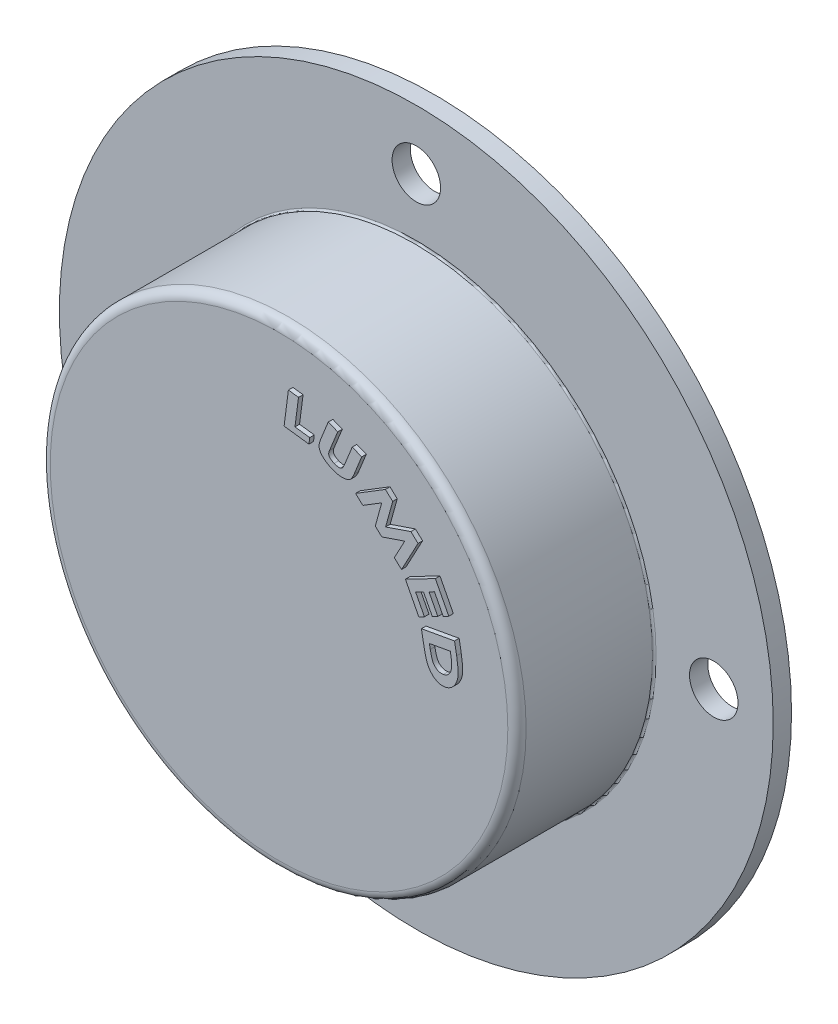
from build123d import *

# Parameters (mm, degrees)
SKETCH1_R            = 39
EXTRUDE1_DEPTH       = 2
SKETCH2_R            = 26
EXTRUDE3_DEPTH       = 15
FILLET1_R            = 1
SHELL1_OUTLINE_R     = 24
SHELL1_DEPTH         = 15
FILLET3_R            = 0.2
FILLET4_R            = 0.5
FILLET5_R            = 1
M5_CLEARANCE_HOLE2_D = 5.3
CIRPATTERN2_COUNT    = 4
EXTRUDE4_DEPTH       = 0.5


# Read off the part's stored shape, not the designer's step: Shell1
with BuildPart() as part:
    # Sketch1 → Extrude1 (new body)
    with BuildSketch(Plane.XY):
        Circle(SKETCH1_R)
    extrude(amount=EXTRUDE1_DEPTH)

    # Sketch2 → Extrude3 (add)
    with BuildSketch(Plane.XY.offset(2)):
        Circle(SKETCH2_R)
    extrude(amount=EXTRUDE3_DEPTH)

    # Fillet1
    fillet1_edges = [part.edges().sort_by_distance(p)[0] for p in [
        (-26, 0, 17),
    ]]
    fillet(fillet1_edges, radius=FILLET1_R)

    # Shell1 outline → Shell1 (cut)
    with BuildSketch(Plane.XY):
        Circle(SHELL1_OUTLINE_R)
    extrude(amount=SHELL1_DEPTH, mode=Mode.SUBTRACT)

    # Fillet3
    fillet3_edges = [part.edges().sort_by_distance(p)[0] for p in [
        (-26, 0, 2),
    ]]
    fillet(fillet3_edges, radius=FILLET3_R)

    # Fillet4
    fillet4_edges = [part.edges().sort_by_distance(p)[0] for p in [
        (-24, 0, 0),
    ]]
    fillet(fillet4_edges, radius=FILLET4_R)

    # Fillet5
    fillet5_edges = [part.edges().sort_by_distance(p)[0] for p in [
        (-24, 0, 15),
    ]]
    fillet(fillet5_edges, radius=FILLET5_R)

    # M5 Clearance Hole2 (through all)
    with Locations(Plane.XY.offset(2)):
        with Locations((0, 32.5)):
            m5_clearance_hole2 = Hole(M5_CLEARANCE_HOLE2_D / 2)

    # CirPattern2: M5 Clearance Hole2 ×4 about axis
    cirpattern2_axis = Axis((0, 0, 0), (0, 0, 1))
    for i in range(1, CIRPATTERN2_COUNT):
        add(m5_clearance_hole2.rotate(cirpattern2_axis, i * 360 / CIRPATTERN2_COUNT), mode=Mode.SUBTRACT)

    # Sketch7 → Extrude4 (add)
    # profile 1 of 5: a face of its own
    with BuildSketch(Plane.XY.offset(17)):
        with BuildLine():
            Line((19.676957621, 5.895197773), (19.909210058, 4.601855926))
            add(Edge.make_bspline(
                [(19.909210058, 4.601855926), (19.926651632, 4.500756414), (19.960375824, 4.305275227), (20.003127109, 4.021131614), (20.035136253, 3.755856277), (20.057801947, 3.50941192), (20.070613778, 3.281967505), (20.074435398, 3.073479481), (20.066961458, 2.884011603), (20.051245996, 2.710939809), (20.024412986, 2.550248712), (19.989932757, 2.397223976), (19.945515818, 2.249766305), (19.894274619, 2.106997056), (19.832166687, 1.970108117), (19.761460303, 1.838667258), (19.682767862, 1.711818388), (19.595037947, 1.5917147), (19.499748057, 1.479638905), (19.396983344, 1.377993746), (19.28704005, 1.288275306), (19.170652181, 1.209353696), (19.046580749, 1.143616013), (18.91635037, 1.087389919), (18.77889519, 1.043285188), (18.68385402, 1.023944482), (18.635902767, 1.014186489)],
                knots=[0, 0, 0, 0, 1.730076892, 3.345194012, 4.845031028, 6.235470528, 7.517952796, 8.685973408, 9.750415481, 10.714141801, 11.614495518, 12.495817449, 13.357576408, 14.209987726, 15.051935834, 15.889834422, 16.725466702, 17.567259816, 18.395636046, 19.203792226, 20.001166367, 20.785517328, 21.571153748, 22.36530307, 23.175244092, 24, 24, 24, 24], degree=3))
            add(Edge.make_bspline(
                [(18.635902767, 1.014186489), (18.601332211, 1.008792177), (18.532676771, 0.998079338), (18.429279177, 0.989999215), (18.326869474, 0.989175032), (18.22517881, 0.995885426), (18.124571089, 1.010143405), (18.024571455, 1.030831771), (17.925656818, 1.059215457), (17.827998765, 1.094745096), (17.732265048, 1.137285173), (17.638741204, 1.185398285), (17.548021241, 1.239670585), (17.460576449, 1.300003798), (17.375273895, 1.365504104), (17.293439096, 1.437570028), (17.213363047, 1.514802593), (17.112225961, 1.626941287), (16.993341681, 1.77534263), (16.86772283, 1.966533878), (16.757516889, 2.168158053), (16.678159583, 2.347681675), (16.62103193, 2.506628847), (16.578084306, 2.647799896), (16.532403009, 2.80962355), (16.487908625, 2.993283627), (16.441312375, 3.197882505), (16.392833179, 3.423332012), (16.345041361, 3.670140713), (16.313480153, 3.841752829), (16.297053942, 3.931069335)],
                knots=[0, 0, 0, 0, 0.700069007, 1.390302967, 2.07345339, 2.748157948, 3.427928198, 4.105586319, 4.790313218, 5.485605459, 6.183746622, 6.885581077, 7.589368078, 8.297874576, 9.010777227, 9.740496332, 10.479143782, 11.236028141, 12.761351436, 14.279847751, 15.808380735, 17.355454046, 18.202580936, 19.187428998, 20.308031537, 21.567474943, 22.968881258, 24.507767656, 26.182447736, 28, 28, 28, 28], degree=3))
            Line((16.297053942, 3.931069335), (16.061091402, 5.244445737))
            Line((16.061091402, 5.244445737), (19.676957621, 5.895197773))
        make_face()
        with BuildLine():
            Line((19.208000623, 4.688672333), (16.929997485, 4.27833496))
            Line((16.929997485, 4.27833496), (17.021266015, 3.771534913))
            add(Edge.make_bspline(
                [(17.021266015, 3.771534913), (17.032345987, 3.711373225), (17.053733, 3.595246685), (17.089409635, 3.428546915), (17.125904798, 3.275194319), (17.162274443, 3.135102557), (17.201293405, 3.00858141), (17.239805196, 2.895047806), (17.280674034, 2.795284581), (17.322803022, 2.707562492), (17.367167925, 2.628795417), (17.415768928, 2.556722787), (17.467747655, 2.489006687), (17.5235422, 2.425554712), (17.583554861, 2.366990452), (17.647740166, 2.313415224), (17.715443468, 2.264358919), (17.78654117, 2.219690581), (17.86093744, 2.180915018), (17.938988478, 2.150582726), (18.019080747, 2.126625083), (18.101820962, 2.110326722), (18.187002339, 2.10138524), (18.27462071, 2.100115904), (18.364754991, 2.105817523), (18.424984256, 2.11557869), (18.455591769, 2.120539153)],
                knots=[0, 0, 0, 0, 1.775092123, 3.426355128, 4.946159467, 6.349362224, 7.625332135, 8.787500866, 9.827139712, 10.751664961, 11.609871591, 12.447943051, 13.271974121, 14.085592912, 14.897690682, 15.702716349, 16.509563741, 17.322105437, 18.137463576, 18.939829159, 19.748303036, 20.560495954, 21.383244435, 22.230303678, 23.100669685, 24, 24, 24, 24], degree=3))
            add(Edge.make_bspline(
                [(18.455591769, 2.120539153), (18.501912095, 2.1305263), (18.592653852, 2.150091173), (18.721035792, 2.198320249), (18.838930231, 2.260006867), (18.945420071, 2.337235377), (19.040204715, 2.429694213), (19.124665474, 2.535983583), (19.198010124, 2.656956303), (19.236010853, 2.745299303), (19.255489939, 2.790583724)],
                knots=[0, 0, 0, 0, 1.038177342, 2.033794765, 2.997232208, 3.948913134, 4.908064258, 5.892578705, 6.919740629, 8, 8, 8, 8], degree=3))
            add(Edge.make_bspline(
                [(19.255489939, 2.790583724), (19.271340372, 2.835554425), (19.304366828, 2.929256779), (19.335515387, 3.082108884), (19.356237644, 3.249799018), (19.363578257, 3.433371754), (19.359499759, 3.632545511), (19.343394445, 3.847458387), (19.316080336, 4.078281915), (19.288886141, 4.236399757), (19.274782474, 4.31840407)],
                knots=[0, 0, 0, 0, 0.739780208, 1.541429103, 2.416204183, 3.362112403, 4.391764505, 5.508663336, 6.707923483, 8, 8, 8, 8], degree=3))
            Line((19.274782474, 4.31840407), (19.208000623, 4.688672333))
        make_face(mode=Mode.SUBTRACT)
    # profile 2 of 5: a face of its own
    with BuildSketch(Plane.XY.offset(17)):
        Polygon((17.581435301, 10.747395777), (19.049151981, 7.917329337), (18.439211075, 7.601228576), (17.479778483, 9.451827868), (16.887646071, 9.144631354), (17.847078663, 7.294032062), (17.248268066, 6.983867465), (16.288835474, 8.834466757), (15.427349597, 8.388512397), (16.386782189, 6.537913105), (15.774615222, 6.220328302), (14.306898542, 9.050394742), align=None)
    # profile 3 of 5: a face of its own
    with BuildSketch(Plane.XY.offset(17)):
        Polygon((12.123844788, 16.457580555), (12.917806794, 15.714817969), (12.143879344, 12.912948311), (14.90345383, 13.856798471), (15.686285527, 13.124424172), (13.88243353, 9.757134842), (13.100343854, 10.488767121), (14.234893299, 12.619108166), (11.735026012, 11.766526536), (11.018976165, 12.436571107), (11.715733477, 14.975765485), (9.656626406, 13.71136244), (8.865632482, 14.451156944), align=None)
    # profile 4 of 5: a face of its own
    with BuildSketch(Plane.XY.offset(17)):
        with BuildLine():
            Line((5.883258698, 19.717752428), (6.913183244, 19.299994849))
            Line((6.913183244, 19.299994849), (6.01756442, 17.092483664))
            add(Edge.make_bspline(
                [(6.01756442, 17.092483664), (6.008486233, 17.069548786), (5.990944466, 17.025231756), (5.968459411, 16.960233961), (5.951756013, 16.899082481), (5.937700658, 16.842866609), (5.929563581, 16.790459558), (5.925628424, 16.742326117), (5.926160317, 16.698062126), (5.932981546, 16.644156349), (5.953878485, 16.579582514), (5.992366342, 16.504378403), (6.046995799, 16.430571608), (6.116233762, 16.35835831), (6.199026795, 16.288695912), (6.296204469, 16.225423966), (6.404381617, 16.164332538), (6.483415994, 16.131018738), (6.524364467, 16.113758537)],
                knots=[0, 0, 0, 0, 0.923038225, 1.783585378, 2.571857434, 3.294764068, 3.950625969, 4.554034933, 5.100209756, 5.604208717, 6.582094882, 7.621105052, 8.754146159, 10.004648243, 11.358032571, 12.793050822, 14.338448695, 16, 16, 16, 16], degree=3))
            add(Edge.make_bspline(
                [(6.524364467, 16.113758537), (6.568381949, 16.096937583), (6.653613085, 16.064367136), (6.781720621, 16.029178008), (6.904523521, 16.008154167), (7.020730873, 16.000176227), (7.127582444, 16.005957413), (7.223056232, 16.022459059), (7.306086108, 16.050112017), (7.366327548, 16.0847227), (7.408808112, 16.121187462), (7.440283212, 16.156538569), (7.473227208, 16.198887508), (7.50531201, 16.249796421), (7.539045, 16.307675031), (7.572073799, 16.374126456), (7.606128878, 16.448155364), (7.628152069, 16.500530119), (7.639621378, 16.527806013)],
                knots=[0, 0, 0, 0, 1.618793555, 3.134473113, 4.557098125, 5.894372325, 7.128811318, 8.225928628, 9.215199246, 10.122001872, 10.59222323, 11.133722231, 11.745813266, 12.4342968, 13.199761712, 14.047507939, 14.983174849, 16, 16, 16, 16], degree=3))
            Line((7.639621378, 16.527806013), (8.502591297, 18.654436956))
            Line((8.502591297, 18.654436956), (9.532515842, 18.235937357))
            Line((9.532515842, 18.235937357), (8.707388973, 16.202058985))
            add(Edge.make_bspline(
                [(8.707388973, 16.202058985), (8.690264857, 16.160919945), (8.657399682, 16.081964525), (8.607108499, 15.969669644), (8.55744861, 15.868768385), (8.509112965, 15.77872354), (8.462814268, 15.699035754), (8.416936123, 15.630448533), (8.37187755, 15.573021449), (8.326805301, 15.525418292), (8.279703663, 15.484600977), (8.228647973, 15.447875675), (8.172850214, 15.413626493), (8.111856943, 15.382432709), (8.046190439, 15.352664304), (7.974955261, 15.326194129), (7.898819327, 15.302555845), (7.790866987, 15.273622216), (7.649377033, 15.247349008), (7.474537056, 15.230788837), (7.294493017, 15.231346738), (7.108853114, 15.247073838), (6.916109728, 15.279574202), (6.715415009, 15.329190125), (6.505627921, 15.395521078), (6.364781141, 15.450317186), (6.29211203, 15.478588933)],
                knots=[0, 0, 0, 0, 1.100735908, 2.112569176, 3.038882457, 3.878101929, 4.636766245, 5.314609658, 5.914814222, 6.437739277, 6.931472359, 7.452107952, 7.989676895, 8.547154927, 9.143334263, 9.769772578, 10.422934341, 11.112083662, 12.529703976, 13.971813743, 15.444304845, 16.971076327, 18.569180017, 20.267430496, 22.074201565, 24, 24, 24, 24], degree=3))
            add(Edge.make_bspline(
                [(6.29211203, 15.478588933), (6.244182676, 15.498433981), (6.149939842, 15.53745503), (6.013814463, 15.602683122), (5.88435309, 15.670306438), (5.761925489, 15.742097212), (5.646414389, 15.816675017), (5.537586093, 15.894793889), (5.435720867, 15.976466149), (5.341250196, 16.061358864), (5.25487038, 16.147851514), (5.176741706, 16.233925948), (5.107139964, 16.319311849), (5.047198038, 16.404936156), (4.994627838, 16.489150823), (4.952167889, 16.573792183), (4.917824859, 16.65753338), (4.891447957, 16.742475337), (4.875614972, 16.831896812), (4.870930006, 16.928509796), (4.876515247, 17.033590153), (4.892769381, 17.147072804), (4.917918785, 17.269428531), (4.955303193, 17.399827213), (5.000827179, 17.539834697), (5.038531814, 17.63460801), (5.058131828, 17.683874055)],
                knots=[0, 0, 0, 0, 1.280434306, 2.517700506, 3.724934716, 4.885287436, 6.020054073, 7.118151758, 8.190968479, 9.241662168, 10.251996506, 11.207382413, 12.110466848, 12.96936814, 13.786218001, 14.559020287, 15.303990097, 16.01869134, 16.7505329, 17.539379253, 18.401400366, 19.344393315, 20.3670884, 21.482635478, 22.691397491, 24, 24, 24, 24], degree=3))
            Line((5.058131828, 17.683874055), (5.883258698, 19.717752428))
        make_face()
    # profile 5 of 5: a face of its own
    with BuildSketch(Plane.XY.offset(17)):
        Polygon((1.522878641, 20.560870651), (2.626263223, 20.419144723), (2.243380611, 17.431769924), (3.852081199, 17.225488206), (3.767490854, 16.56286384), (1.055405684, 16.910871486), align=None)
    extrude(amount=EXTRUDE4_DEPTH)


solid = part.part
